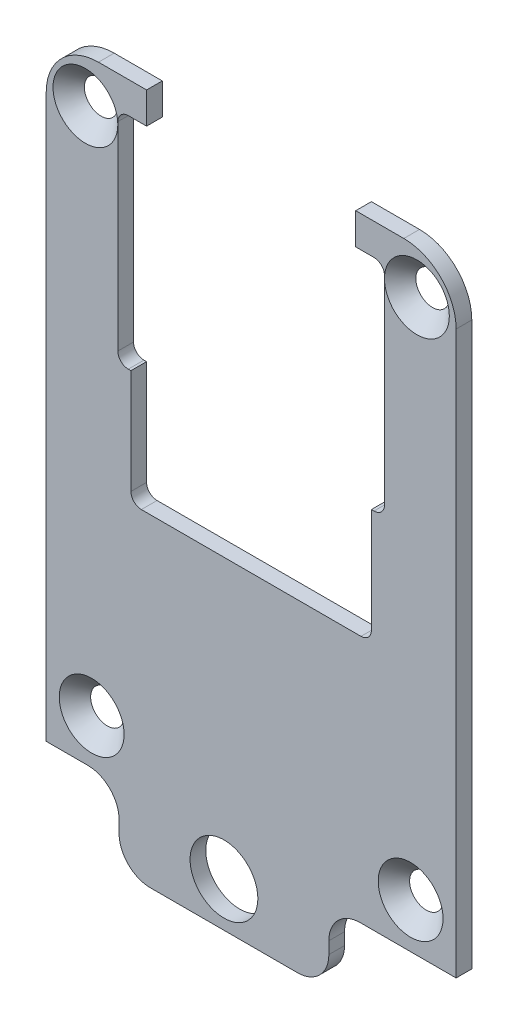
from build123d import *

# Parameters (mm, degrees)
SKETCH1_W                        = 39.2
SKETCH1_H                        = 58.746225757
BASE_DEPTH                       = 1.5
FRONT_FILLET_R                   = 5
BOLT_HOLE_CUT_REACH              = 51.194
SKETCH4_R                        = 1.6
BOLT_HEAD_CHAMBER_SIZE           = 1.5
CAMRA_HOLE_REACH                 = 51.194
SKETCH2_W                        = 23
SKETCH2_H                        = 21
SKETCH2_W_2                      = 1.25
SKETCH2_H_2                      = 3
SKETCH2_H_3                      = 8
SKETCH9_W                        = 1.5
SKETCH9_H                        = 3
CAMERA_SIDE_MOUNT_HOLDER_DEPTH   = 1.5
FILLET1_R                        = 1
SKETCH12_W                       = 20.06
SKETCH12_H                       = 7.149851194
ANTENNA_CONNECTOR_TOP_BASE_DEPTH = 1.5
ANTENNA_CONNECTOR_TOP_CUT_REACH  = 55.424
SKETCH13_R                       = 3.24
ANTENNA_TOP_CONNECTOR_FILLET_R   = 3
FILLET2_R                        = 1


with BuildPart() as part:
    # Sketch1 → Base (new body)
    with BuildSketch(Plane.XY):
        with Locations((19.622719192, 0.281239742)):
            Rectangle(SKETCH1_W, SKETCH1_H)
    extrude(amount=BASE_DEPTH)

    # Front fillet
    front_fillet_edges = [part.edges().sort_by_distance(p)[0] for p in [
        (0.022719192, 29.65435262, 0.75),
        (39.222719192, 29.65435262, 0.75),
    ]]
    fillet(front_fillet_edges, radius=FRONT_FILLET_R)

    # Sketch4 → Bolt hole cut (cut, up to next)
    with BuildSketch(Plane.XY.offset(1.5), mode=Mode.PRIVATE) as bolt_hole_cut_sk1:
        with Locations((34.872719192, -24.79564738)):
            Circle(SKETCH4_R)
    bolt_hole_cut_tool1 = extrude(bolt_hole_cut_sk1.sketch, amount=-BOLT_HOLE_CUT_REACH, mode=Mode.PRIVATE) & part.part
    # Sketch4 → Bolt hole cut (cut, up to next)
    with BuildSketch(Plane.XY.offset(1.5), mode=Mode.PRIVATE) as bolt_hole_cut_sk2:
        with Locations((4.372719192, -24.79564738)):
            Circle(SKETCH4_R)
    bolt_hole_cut_tool2 = extrude(bolt_hole_cut_sk2.sketch, amount=-BOLT_HOLE_CUT_REACH, mode=Mode.PRIVATE) & part.part
    # Sketch4 → Bolt hole cut (cut, up to next)
    with BuildSketch(Plane.XY.offset(1.5), mode=Mode.PRIVATE) as bolt_hole_cut_sk3:
        with Locations((3.772719192, 25.408275669)):
            Circle(SKETCH4_R)
    bolt_hole_cut_tool3 = extrude(bolt_hole_cut_sk3.sketch, amount=-BOLT_HOLE_CUT_REACH, mode=Mode.PRIVATE) & part.part
    # Sketch4 → Bolt hole cut (cut, up to next)
    with BuildSketch(Plane.XY.offset(1.5), mode=Mode.PRIVATE) as bolt_hole_cut_sk4:
        with Locations((35.472719192, 25.408275669)):
            Circle(SKETCH4_R)
    bolt_hole_cut_tool4 = extrude(bolt_hole_cut_sk4.sketch, amount=-BOLT_HOLE_CUT_REACH, mode=Mode.PRIVATE) & part.part
    add(bolt_hole_cut_tool1.solids().sort_by_distance((34.872719, -24.795647, 1.5))[0], mode=Mode.SUBTRACT)
    add(bolt_hole_cut_tool2.solids().sort_by_distance((4.372719, -24.795647, 1.5))[0], mode=Mode.SUBTRACT)
    add(bolt_hole_cut_tool3.solids().sort_by_distance((3.772719, 25.408276, 1.5))[0], mode=Mode.SUBTRACT)
    add(bolt_hole_cut_tool4.solids().sort_by_distance((35.472719, 25.408276, 1.5))[0], mode=Mode.SUBTRACT)

    # Bolt head chamber
    bolt_head_chamber_edges = [part.edges().sort_by_distance(p)[0] for p in [
        (33.272719192, -24.79564738, 1.5),
        (2.772719192, -24.79564738, 1.5),
        (2.172719192, 25.408275669, 1.5),
        (33.872719192, 25.408275669, 1.5),
    ]]
    chamfer(bolt_head_chamber_edges, length=BOLT_HEAD_CHAMBER_SIZE - 0.0001)  # a hair under: the kernel refuses the full size

    # Sketch2 → Camra hole (cut, up to next)
    with BuildSketch(Plane.XY.offset(1.5), mode=Mode.PRIVATE) as camra_hole_sk1:
        with Locations((19.622719192, 16.15435262)):
            Rectangle(SKETCH2_W, SKETCH2_H)
    camra_hole_tool1 = extrude(camra_hole_sk1.sketch, amount=-CAMRA_HOLE_REACH, mode=Mode.PRIVATE) & part.part
    # Sketch2 → Camra hole (cut, up to next)
    with BuildSketch(Plane.XY.offset(1.5), mode=Mode.PRIVATE) as camra_hole_sk2:
        with Locations((7.497719192, 16.15435262)):
            Rectangle(SKETCH2_W_2, SKETCH2_H)
    camra_hole_tool2 = extrude(camra_hole_sk2.sketch, amount=-CAMRA_HOLE_REACH, mode=Mode.PRIVATE) & part.part
    # Sketch2 → Camra hole (cut, up to next)
    with BuildSketch(Plane.XY.offset(1.5), mode=Mode.PRIVATE) as camra_hole_sk3:
        with Locations((31.747719192, 16.15435262)):
            Rectangle(SKETCH2_W_2, SKETCH2_H)
    camra_hole_tool3 = extrude(camra_hole_sk3.sketch, amount=-CAMRA_HOLE_REACH, mode=Mode.PRIVATE) & part.part
    # Sketch2 → Camra hole (cut, up to next)
    with BuildSketch(Plane.XY.offset(1.5), mode=Mode.PRIVATE) as camra_hole_sk4:
        with Locations((19.622719192, 4.15435262)):
            Rectangle(SKETCH2_W, SKETCH2_H_2)
    camra_hole_tool4 = extrude(camra_hole_sk4.sketch, amount=-CAMRA_HOLE_REACH, mode=Mode.PRIVATE) & part.part
    # Sketch2 → Camra hole (cut, up to next)
    with BuildSketch(Plane.XY.offset(1.5), mode=Mode.PRIVATE) as camra_hole_sk5:
        with Locations((19.622719192, -1.34564738)):
            Rectangle(SKETCH2_W, SKETCH2_H_3)
    camra_hole_tool5 = extrude(camra_hole_sk5.sketch, amount=-CAMRA_HOLE_REACH, mode=Mode.PRIVATE) & part.part
    # Sketch2 → Camra hole (cut, up to next)
    with BuildSketch(Plane.XY.offset(1.5), mode=Mode.PRIVATE) as camra_hole_sk6:
        with Locations((19.622719192, 28.15435262)):
            Rectangle(SKETCH2_W, SKETCH2_H_2)
    camra_hole_tool6 = extrude(camra_hole_sk6.sketch, amount=-CAMRA_HOLE_REACH, mode=Mode.PRIVATE) & part.part
    add(camra_hole_tool1.solids().sort_by_distance((19.622719, 16.154353, 1.5))[0], mode=Mode.SUBTRACT)
    add(camra_hole_tool2.solids().sort_by_distance((7.497719, 16.154353, 1.5))[0], mode=Mode.SUBTRACT)
    add(camra_hole_tool3.solids().sort_by_distance((31.747719, 16.154353, 1.5))[0], mode=Mode.SUBTRACT)
    add(camra_hole_tool4.solids().sort_by_distance((19.622719, 4.154353, 1.5))[0], mode=Mode.SUBTRACT)
    add(camra_hole_tool5.solids().sort_by_distance((19.622719, -1.345647, 1.5))[0], mode=Mode.SUBTRACT)
    add(camra_hole_tool6.solids().sort_by_distance((19.622719, 28.154353, 1.5))[0], mode=Mode.SUBTRACT)

    # Sketch9 → Camera side mount holder (add)
    with BuildSketch(Plane.XY.offset(1.5)):
        with Locations((8.872719192, 28.15435262)):
            Rectangle(SKETCH9_W, SKETCH9_H)
        with Locations((30.372719192, 28.15435262)):
            Rectangle(SKETCH9_W, SKETCH9_H)
    extrude(amount=-CAMERA_SIDE_MOUNT_HOLDER_DEPTH)

    # Fillet1
    fillet1_edges = [part.edges().sort_by_distance(p)[0] for p in [
        (32.372719192, 5.65435262, 0.75),
        (6.872719192, 5.65435262, 0.75),
    ]]
    fillet(fillet1_edges, radius=FILLET1_R)

    # Sketch12 → Antenna connector top base (add)
    with BuildSketch(Plane(origin=(0, 0, 0), x_dir=(-1, 0, 0), z_dir=(0, 0, -1))):
        with Locations((-17.022719192, -32.666798734)):
            Rectangle(SKETCH12_W, SKETCH12_H)
    extrude(amount=-ANTENNA_CONNECTOR_TOP_BASE_DEPTH)

    # Sketch13 → Antenna connector top cut (cut, up to next)
    with BuildSketch(Plane.XY.offset(1.5), mode=Mode.PRIVATE) as antenna_connector_top_cut_sk1:
        with Locations((17.022719192, -31.991873137)):
            Circle(SKETCH13_R)
    antenna_connector_top_cut_tool1 = extrude(antenna_connector_top_cut_sk1.sketch, amount=-ANTENNA_CONNECTOR_TOP_CUT_REACH, mode=Mode.PRIVATE) & part.part
    add(antenna_connector_top_cut_tool1.solids().sort_by_distance((17.022719, -31.991873, 1.5))[0], mode=Mode.SUBTRACT)

    # Antenna top connector fillet
    antenna_top_connector_fillet_edges = [part.edges().sort_by_distance(p)[0] for p in [
        (27.052719192, -29.091873137, 0.75),
        (27.052719192, -36.241724331, 0.75),
        (6.992719192, -36.241724331, 0.75),
        (6.992719192, -29.091873137, 0.75),
    ]]
    fillet(antenna_top_connector_fillet_edges, radius=ANTENNA_TOP_CONNECTOR_FILLET_R)

    # Fillet2
    fillet2_edges = [part.edges().sort_by_distance(p)[0] for p in [
        (32.372719192, 26.65435262, 0.75),
        (31.122719192, -5.34564738, 0.75),
        (8.122719192, -5.34564738, 0.75),
        (6.872719192, 26.65435262, 0.75),
    ]]
    fillet(fillet2_edges, radius=FILLET2_R)


solid = part.part
